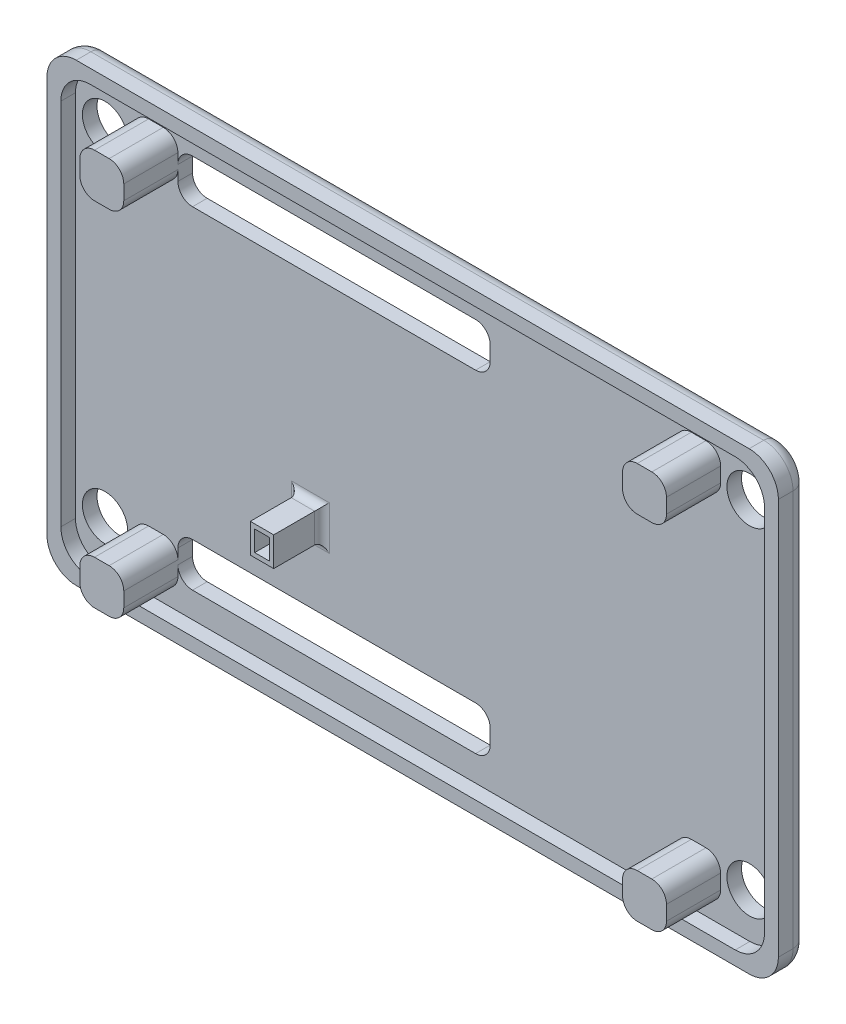
from build123d import *

# Parameters (mm, degrees)
SKETCH1_W           = 50
SKETCH1_H           = 31.1
BOSS_EXTRUDE1_DEPTH = 1
SKETCH2_W           = 50
SKETCH2_H           = 31.1
SKETCH2_W_2         = 48.1
SKETCH2_H_2         = 29.2
BOSS_EXTRUDE2_DEPTH = 1
SKETCH3_W           = 3
SKETCH3_H           = 3
BOSS_EXTRUDE3_DEPTH = 3.7
SKETCH4_R           = 1.55
CUT_EXTRUDE1_DEPTH  = 1
SKETCH5_W           = 21.35
SKETCH5_H           = 3
SKETCH5_W_2         = 1
SKETCH5_H_2         = 1.4
CUT_EXTRUDE2_DEPTH  = 1
SKETCH6_W           = 1.6
SKETCH6_H           = 2
SKETCH6_W_2         = 1
SKETCH6_H_2         = 1.4
BOSS_EXTRUDE4_DEPTH = 3.3
FILLET1_R           = 2
FILLET2_R           = 1
FILLET3_R           = 1
FILLET4_R           = 1
FILLET5_R           = 0.5
FILLET6_R           = 0.5


with BuildPart() as part:
    # Sketch1 → Boss-Extrude1 (new body)
    with BuildSketch(Plane.XY):
        Rectangle(SKETCH1_W, SKETCH1_H)
    extrude(amount=BOSS_EXTRUDE1_DEPTH)

    # Sketch2 → Boss-Extrude2 (add)
    with BuildSketch(Plane.XY.offset(1)):
        Rectangle(SKETCH2_W, SKETCH2_H)
        Rectangle(SKETCH2_W_2, SKETCH2_H_2, mode=Mode.SUBTRACT)
    extrude(amount=BOSS_EXTRUDE2_DEPTH)

    # Sketch3 → Boss-Extrude3 (add)
    with BuildSketch(Plane.XY.offset(1)):
        with Locations((18.55, 12.05)):
            Rectangle(SKETCH3_W, SKETCH3_H)
        with Locations((-18.55, 12.05)):
            Rectangle(SKETCH3_W, SKETCH3_H)
        with Locations((18.55, -12.05)):
            Rectangle(SKETCH3_W, SKETCH3_H)
        with Locations((-18.55, -12.05)):
            Rectangle(SKETCH3_W, SKETCH3_H)
    extrude(amount=BOSS_EXTRUDE3_DEPTH)

    # Sketch4 → Cut-Extrude1 (cut)
    with BuildSketch(Plane.XY.offset(1)):
        with Locations((-22.03, 11.55)):
            Circle(SKETCH4_R)
        with Locations(Location((22.03, 11.55, 0), (0, 0, 180))):
            Circle(SKETCH4_R)
        with Locations(Location((-22.03, -11.55, 0), (0, 0, 180))):
            Circle(SKETCH4_R)
        with Locations((22.03, -11.55)):
            Circle(SKETCH4_R)
    extrude(amount=-CUT_EXTRUDE1_DEPTH, mode=Mode.SUBTRACT)

    # Sketch5 → Cut-Extrude2 (cut)
    with BuildSketch(Plane.XY.offset(1)):
        with Locations((-6.375, 11.35)):
            Rectangle(SKETCH5_W, SKETCH5_H)
        with Locations((-6.375, -11.35)):
            Rectangle(SKETCH5_W, SKETCH5_H)
        with Locations((-8, -4.5)):
            Rectangle(SKETCH5_W_2, SKETCH5_H_2)
    extrude(amount=-CUT_EXTRUDE2_DEPTH, mode=Mode.SUBTRACT)

    # Sketch6 → Boss-Extrude4 (add)
    with BuildSketch(Plane.XY.offset(1)):
        with Locations((-8, -4.5)):
            Rectangle(SKETCH6_W, SKETCH6_H)
        with Locations((-8, -4.5)):
            Rectangle(SKETCH6_W_2, SKETCH6_H_2, mode=Mode.SUBTRACT)
    extrude(amount=BOSS_EXTRUDE4_DEPTH)

    # Fillet1
    fillet1_edges = [part.edges().sort_by_distance(p)[0] for p in [
        (24.05, 14.6, 1.5),
        (-24.05, 14.6, 1.5),
        (-24.05, -14.6, 1.5),
        (24.05, -14.6, 1.5),
        (25, -15.55, 1),
        (-25, -15.55, 1),
        (-25, 15.55, 1),
        (25, 15.55, 1),
    ]]
    fillet(fillet1_edges, radius=FILLET1_R)

    # Fillet2
    fillet2_edges = [part.edges().sort_by_distance(p)[0] for p in [
        (-20.05, -13.55, 2.85),
        (-17.05, -13.55, 2.85),
        (-17.05, -10.55, 2.85),
        (-20.05, -10.55, 2.85),
        (20.05, 13.55, 2.85),
        (17.05, 13.55, 2.85),
        (17.05, 10.55, 2.85),
        (20.05, 10.55, 2.85),
        (-20.05, 10.55, 2.85),
        (-17.05, 10.55, 2.85),
        (-17.05, 13.55, 2.85),
        (20.05, -13.55, 2.85),
        (20.05, -10.55, 2.85),
        (17.05, -10.55, 2.85),
        (17.05, -13.55, 2.85),
        (-20.05, 13.55, 2.85),
    ]]
    fillet(fillet2_edges, radius=FILLET2_R)

    # Fillet3
    fillet3_edges = [part.edges().sort_by_distance(p)[0] for p in [
        (25, 0, 0),
        (0, -15.55, 0),
        (-25, 0, 0),
        (0, 15.55, 0),
        (-24.414213562, 14.964213562, 0),
        (24.414213562, 14.964213562, 0),
        (-24.414213562, -14.964213562, 0),
        (24.414213562, -14.964213562, 0),
    ]]
    fillet(fillet3_edges, radius=FILLET3_R)

    # Fillet4
    # the kernel refuses this fillet: 1 mm, written as the material it adds along each edge
    with BuildSketch(Plane(origin=(4.3, -9.85, 1), x_dir=(-1, 0, 0), z_dir=(0, 0, -1)), Plane(origin=(-17.05, -9.85, 1), x_dir=(0, -1, 0), z_dir=(0, 0, -1)), Plane(origin=(4.3, 12.85, 1), x_dir=(-1, 0, 0), z_dir=(0, 0, -1)), Plane(origin=(4.3, 9.85, 1), x_dir=(0, 1, 0), z_dir=(0, 0, -1))) as fillet4_piece_1:
        with BuildLine():
            CenterArc((FILLET4_R, -FILLET4_R), FILLET4_R, 90, 90)
            Line((0, -FILLET4_R), (0, 0))
            Line((0, 0), (FILLET4_R, 0))
        make_face()
    extrude(amount=1)
    with BuildSketch(Plane(origin=(4.3, -12.85, 1), x_dir=(-1, 0, 0), z_dir=(0, 0, -1)), Plane(origin=(-17.05, 9.85, 1), x_dir=(0, 1, 0), z_dir=(0, 0, -1))) as fillet4_piece_2:
        with BuildLine():
            CenterArc((FILLET4_R, FILLET4_R), FILLET4_R, 180, 90)
            Line((0, FILLET4_R), (0, 0))
            Line((0, 0), (FILLET4_R, 0))
        make_face()
    extrude(amount=1)
    with BuildSketch(Plane(origin=(-17.096060799, -12.85, 0), x_dir=(0.04601201496386327, 0.9989408863786512, 0), z_dir=(0, 0, 1))) as fillet4_piece_3:
        with BuildLine():
            CenterArc((1.047072251, -0.998940886), FILLET4_R, 92.637225371, 90)
            Line((0.048131365, -1.044952901), (-0.051762724, -1.049554103))
            Line((-0.051762724, -1.049554103), (-0.099894089, -0.004601201))
            Line((-0.099894089, -0.004601201), (0.02557896, 0.096673248))
            ThreePointArc((0.02557896, 0.096673248), (0.297200415, 0.067685678), (0.996459035, 0.099894089))
            Line((0.996459035, 0.099894089), (1.001060237, 0))
        make_face()
    extrude(amount=1)
    with BuildSketch(Plane(origin=(-17.096060799, 12.85, 0), x_dir=(1, 0, 0), z_dir=(0, 0, 1))) as fillet4_piece_4:
        with BuildLine():
            CenterArc((1.046060799, -1), FILLET4_R, 90, 90)
            Line((0.046060799, -1), (-0.053939201, -1))
            ThreePointArc((-0.053939201, -1), (-0.053939201, -0.3), (-0.09539392, -0.03))
            Line((-0.09539392, -0.03), (0, 0.1))
            Line((0, 0.1), (1.046060799, 0.1))
            Line((1.046060799, 0.1), (1.046060799, 0))
        make_face()
    extrude(amount=1)

    # Fillet5
    fillet5_edges = [part.edges().sort_by_distance(p)[0] for p in [
        (-7.2, -4.5, 1),
        (-8, -3.5, 1),
        (-8.8, -4.5, 1),
        (-8, -5.5, 1),
    ]]
    fillet(fillet5_edges, radius=FILLET5_R)

    # Fillet6
    fillet6_edges = [part.edges().sort_by_distance(p)[0] for p in [
        (-8, -5.2, 0),
        (-7.5, -4.5, 0),
        (-8, -3.8, 0),
        (-8.5, -4.5, 0),
    ]]
    fillet(fillet6_edges, radius=FILLET6_R)


solid = part.part
